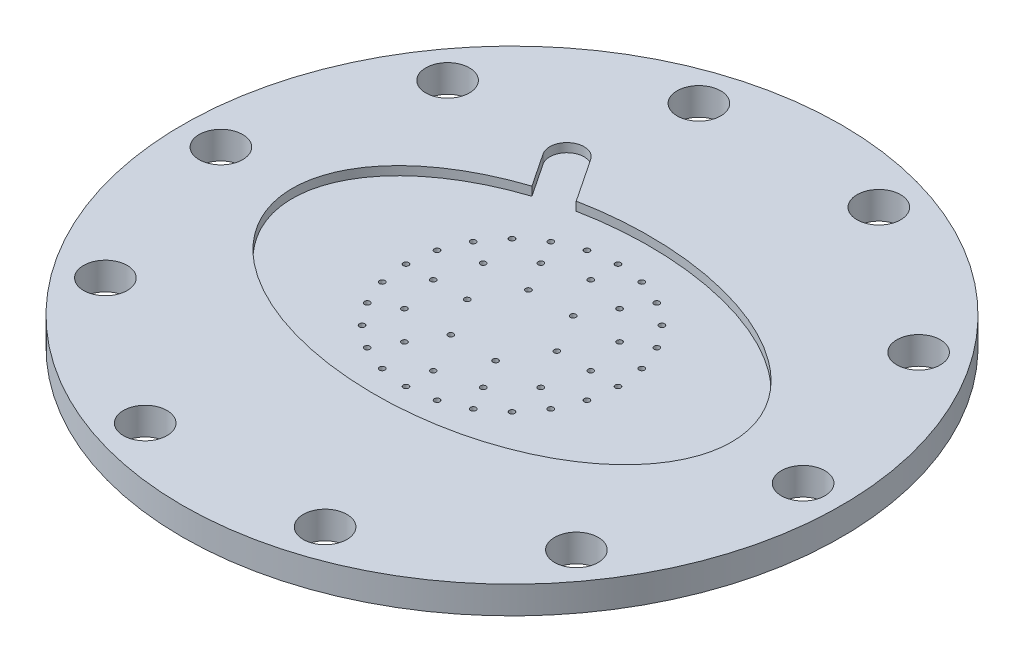
from build123d import *

# Parameters (mm, degrees)
F_3_8_CLEARANCE_HOLE1_D = 10.0838
CIRPATTERN1_COUNT       = 10
SKETCH5_RX              = 50.8
SKETCH5_RY              = 31.75
CUT_EXTRUDE1_DEPTH      = 2.032
SKETCH6_R               = 0.635
CUT_EXTRUDE2_DEPTH      = 108.849548557


with BuildPart() as part:
    # Sketch1 → Revolve1 (revolve)
    with BuildSketch(Plane.XY):
        Polygon((0, -6.35), (54.8259, -6.35), (54.8259, -3.6576), (58.8899, -3.6576), (58.8899, -6.35), (76.2, -6.35), (76.2, 0), (0, 0), align=None)
    revolve(axis=Axis((0, 0, 0), (0, -1, 0)))

    # 3/8 Clearance Hole1 (through all)
    with Locations(Plane(origin=(67.31, 0, 0), x_dir=(0, 0, 1), z_dir=(0, 1, 0))):
        with Locations((0, 0)):
            f_3_8_clearance_hole1 = Hole(F_3_8_CLEARANCE_HOLE1_D / 2)

    # CirPattern1: 3/8 Clearance Hole1 ×10 about axis
    cirpattern1_axis = Axis((0, 0.3175, 0), (0, -1, 0))
    for i in range(1, CIRPATTERN1_COUNT):
        add(f_3_8_clearance_hole1.rotate(cirpattern1_axis, i * 360 / CIRPATTERN1_COUNT), mode=Mode.SUBTRACT)

    # Sketch5 → Cut-Extrude1 (cut)
    with BuildSketch(Plane(origin=(0, 0, 0), x_dir=(1, 0, 0), z_dir=(0, 1, 0))):
        with Locations((0, 0)):
            Ellipse(SKETCH5_RX, SKETCH5_RY)
        with BuildLine():
            Line((-3.302199606, -2.201466404), (-28.702199606, 35.898533596))
            ThreePointArc((-28.702199606, 35.898533596), (-27.601466404, 41.402199606), (-22.097800394, 40.301466404))
            Line((-22.097800394, 40.301466404), (3.302199606, 2.201466404))
            ThreePointArc((3.302199606, 2.201466404), (2.201466404, -3.302199606), (-3.302199606, -2.201466404))
        make_face()
    extrude(amount=-CUT_EXTRUDE1_DEPTH, mode=Mode.SUBTRACT)

    # Sketch6 → Cut-Extrude2 (cut, through all)
    with BuildSketch(Plane(origin=(0, -2.032, 0), x_dir=(1, 0, 0), z_dir=(0, 1, 0))):
        with Locations((-5.1816, -8.974794464)):
            Circle(SKETCH6_R)
        with Locations((5.1816, -8.974794464)):
            Circle(SKETCH6_R)
        with Locations((24.511, 0)):
            Circle(SKETCH6_R)
        with Locations((18.2118, 0)):
            Circle(SKETCH6_R)
        with Locations((10.3632, 0)):
            Circle(SKETCH6_R)
        with Locations((0, -18.2118)):
            Circle(SKETCH6_R)
        with Locations((9.1059, -15.771881449)):
            Circle(SKETCH6_R)
        with Locations((15.771881449, -9.1059)):
            Circle(SKETCH6_R)
        with Locations((5.1816, 8.974794464)):
            Circle(SKETCH6_R)
        with Locations((-5.1816, 8.974794464)):
            Circle(SKETCH6_R)
        with Locations((-10.3632, 0)):
            Circle(SKETCH6_R)
        with Locations((15.771881449, 9.1059)):
            Circle(SKETCH6_R)
        with Locations((9.1059, 15.771881449)):
            Circle(SKETCH6_R)
        with Locations((0, 18.2118)):
            Circle(SKETCH6_R)
        with Locations((-9.1059, 15.771881449)):
            Circle(SKETCH6_R)
        with Locations((-15.771881449, 9.1059)):
            Circle(SKETCH6_R)
        with Locations((-18.2118, 0)):
            Circle(SKETCH6_R)
        with Locations((-15.771881449, -9.1059)):
            Circle(SKETCH6_R)
        with Locations((-9.1059, -15.771881449)):
            Circle(SKETCH6_R)
        with Locations((-6.343913615, -23.675807928)):
            Circle(SKETCH6_R)
        with Locations((0, -24.511)):
            Circle(SKETCH6_R)
        with Locations((6.343913615, -23.675807928)):
            Circle(SKETCH6_R)
        with Locations((12.2555, -21.227148672)):
            Circle(SKETCH6_R)
        with Locations((17.331894314, -17.331894314)):
            Circle(SKETCH6_R)
        with Locations((21.227148672, -12.2555)):
            Circle(SKETCH6_R)
        with Locations((23.675807928, -6.343913615)):
            Circle(SKETCH6_R)
        with Locations((-17.331894314, 17.331894314)):
            Circle(SKETCH6_R)
        with Locations((-21.227148672, 12.2555)):
            Circle(SKETCH6_R)
        with Locations((-23.675807928, 6.343913615)):
            Circle(SKETCH6_R)
        with Locations((-24.511, 0)):
            Circle(SKETCH6_R)
        with Locations((-23.675807928, -6.343913615)):
            Circle(SKETCH6_R)
        with Locations((-21.227148672, -12.2555)):
            Circle(SKETCH6_R)
        with Locations((-17.331894314, -17.331894314)):
            Circle(SKETCH6_R)
        with Locations((-12.2555, -21.227148672)):
            Circle(SKETCH6_R)
        with Locations((23.675807928, 6.343913615)):
            Circle(SKETCH6_R)
        with Locations((21.227148672, 12.2555)):
            Circle(SKETCH6_R)
        with Locations((17.331894314, 17.331894314)):
            Circle(SKETCH6_R)
        with Locations((12.2555, 21.227148672)):
            Circle(SKETCH6_R)
        with Locations((6.343913615, 23.675807928)):
            Circle(SKETCH6_R)
        with Locations((0, 24.511)):
            Circle(SKETCH6_R)
        with Locations((-6.343913615, 23.675807928)):
            Circle(SKETCH6_R)
        with Locations((-12.2555, 21.227148672)):
            Circle(SKETCH6_R)
    extrude(amount=-CUT_EXTRUDE2_DEPTH, mode=Mode.SUBTRACT)


solid = part.part
